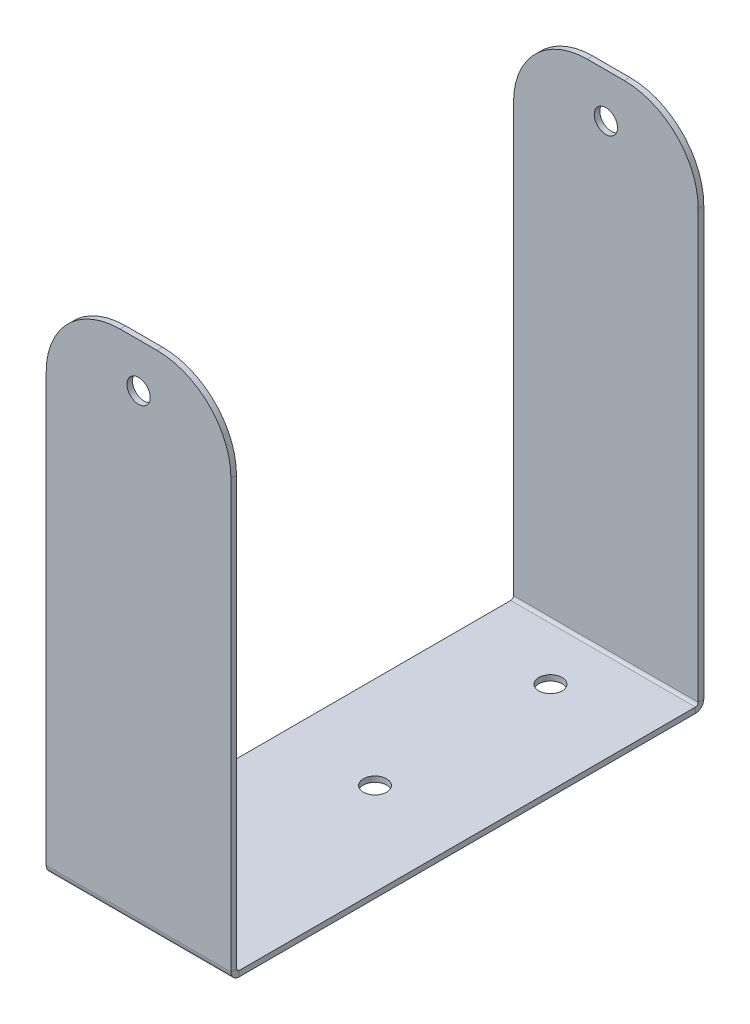
from build123d import *

# Parameters (mm, degrees)
SKETCH1_W                    = 50
SKETCH1_H                    = 125
BASE_FLANGE1_DEPTH           = 1.5
EDGE_FLANGE1_STRIP_W         = 7.5
EDGE_FLANGE1_STRIP_H         = 1.5
EDGE_FLANGE1_STRIP_CUT_DEPTH = 50
EDGE_FLANGE1_DEPTH           = 50
SKETCH9_R                    = 3.15
CUT_EXTRUDE1_DEPTH           = 176
EDGE_FLANGE2_STRIP_W         = 7.5
EDGE_FLANGE2_STRIP_H         = 1.5
EDGE_FLANGE2_STRIP_CUT_DEPTH = 50
EDGE_FLANGE2_DEPTH           = 50
CUT_EXTRUDE2_START           = -10
SKETCH13_R                   = 3.15
CUT_EXTRUDE2_DEPTH           = 10
FILLET1_R                    = 20
SKETCH14_R                   = 3.15
CUT_EXTRUDE3_DEPTH           = 10


# Sheet-metal steps are written as plain solids
with BuildPart() as part:
    # Sketch1 → Base-Flange1 (new body)
    with BuildSketch(Plane(origin=(0, 0, 0), x_dir=(1, 0, 0), z_dir=(0, 1, 0))):
        with Locations((25, -62.5)):
            Rectangle(SKETCH1_W, SKETCH1_H)
    extrude(amount=-BASE_FLANGE1_DEPTH)

    # Edge-Flange1 strip (across the edge) → Edge-Flange1 strip cut (cut)
    with BuildSketch(Plane(origin=(0, 0, 125), x_dir=(0, 0, -1), z_dir=(1, 0, 0))):
        with Locations((-3, -0.75)):
            Rectangle(EDGE_FLANGE1_STRIP_W, EDGE_FLANGE1_STRIP_H)
    extrude(amount=EDGE_FLANGE1_STRIP_CUT_DEPTH, mode=Mode.SUBTRACT)

    # Edge-Flange1 section (across the edge) → Edge-Flange1 (add)
    with BuildSketch(Plane(origin=(0, 0, 125), x_dir=(0, 0, -1), z_dir=(1, 0, 0))):
        with BuildLine():
            Line((-1.5, 0.75), (-1.5, 136.5))
            Line((-1.5, 136.5), (0, 136.5))
            Line((0, 136.5), (0, 0.75))
            ThreePointArc((0, 0.75), (0.219669914, 0.219669914), (0.75, 0))
            Line((0.75, 0), (0.75, -1.5))
            ThreePointArc((0.75, -1.5), (-0.840990258, -0.840990258), (-1.5, 0.75))
        make_face()
    extrude(amount=EDGE_FLANGE1_DEPTH)

    # Sketch9 → Cut-Extrude1 (cut)
    with BuildSketch(Plane.XY.offset(126.5)):
        with Locations((25, 124.5)):
            Circle(SKETCH9_R)
    extrude(amount=-CUT_EXTRUDE1_DEPTH, mode=Mode.SUBTRACT)

    # Edge-Flange2 strip (across the edge) → Edge-Flange2 strip cut (cut)
    with BuildSketch(Plane.ZY.offset(-50)):
        with Locations((-3, -0.75)):
            Rectangle(EDGE_FLANGE2_STRIP_W, EDGE_FLANGE2_STRIP_H)
    extrude(amount=EDGE_FLANGE2_STRIP_CUT_DEPTH, mode=Mode.SUBTRACT)

    # Edge-Flange2 section (across the edge) → Edge-Flange2 (add)
    with BuildSketch(Plane.ZY.offset(-50)):
        with BuildLine():
            Line((-1.5, 0.75), (-1.5, 136.5))
            Line((-1.5, 136.5), (0, 136.5))
            Line((0, 136.5), (0, 0.75))
            ThreePointArc((0, 0.75), (0.219669914, 0.219669914), (0.75, 0))
            Line((0.75, 0), (0.75, -1.5))
            ThreePointArc((0.75, -1.5), (-0.840990258, -0.840990258), (-1.5, 0.75))
        make_face()
    extrude(amount=EDGE_FLANGE2_DEPTH)

    # Sketch13 → Cut-Extrude2 (cut)
    with BuildSketch(Plane(origin=(0, 0, -1.5), x_dir=(-1, 0, 0), z_dir=(0, 0, -1)).offset(CUT_EXTRUDE2_START)):
        with Locations(Location((-25, 124.5, 0), (0, 0, 180))):
            Circle(SKETCH13_R)
    extrude(amount=CUT_EXTRUDE2_DEPTH, mode=Mode.SUBTRACT)

    # Fillet1
    fillet1_edges = [part.edges().sort_by_distance(p)[0] for p in [
        (0, 136.5, 125.75),
        (50, 136.5, 125.75),
        (50, 136.5, -0.75),
        (0, 136.5, -0.75),
    ]]
    fillet(fillet1_edges, radius=FILLET1_R)

    # Sketch14 → Cut-Extrude3 (cut)
    with BuildSketch(Plane(origin=(0, 0, 0), x_dir=(1, 0, 0), z_dir=(0, 1, 0))):
        with Locations(Location((25, -15, 0), (0, 0, 270))):
            Circle(SKETCH14_R)
        with Locations(Location((25, -62.5, 0), (0, 0, 270))):
            Circle(SKETCH14_R)
        with Locations(Location((25, -110, 0), (0, 0, 270))):
            Circle(SKETCH14_R)
    extrude(amount=-CUT_EXTRUDE3_DEPTH, mode=Mode.SUBTRACT)


solid = part.part
